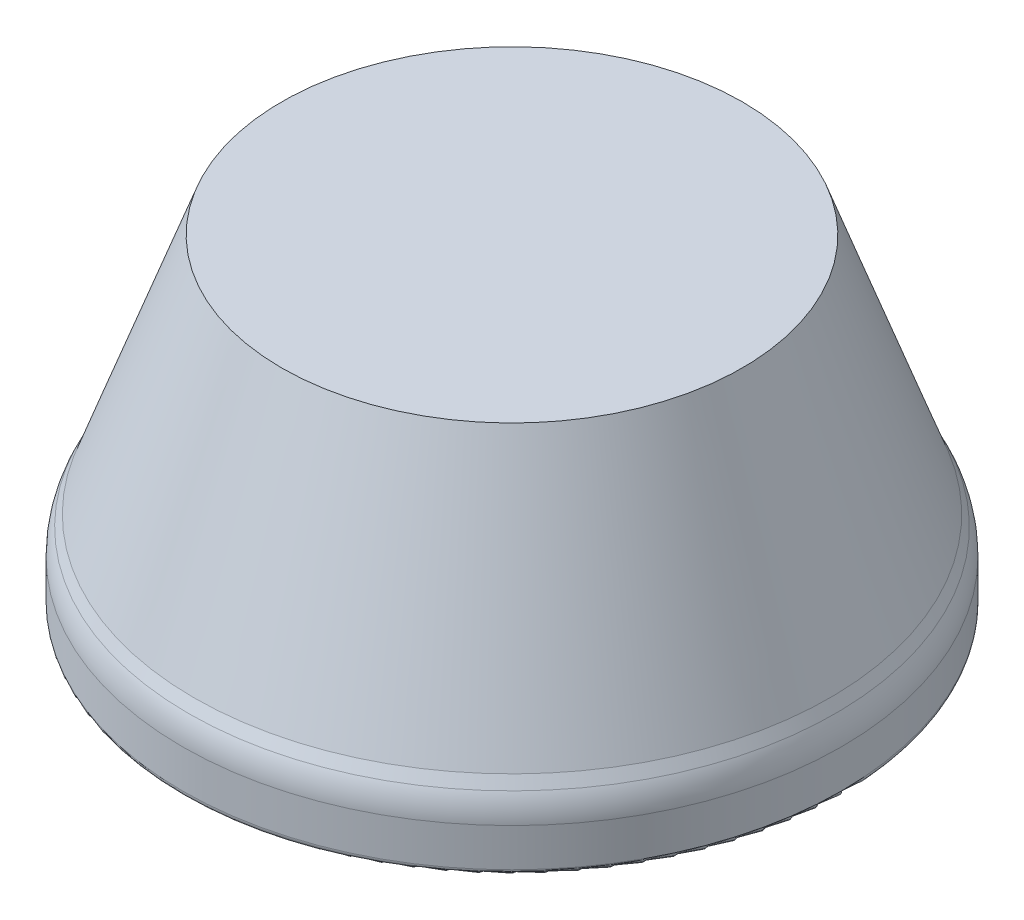
from build123d import *

# Parameters (mm, degrees)
SKETCH33_R          = 28.6
SKETCH33_R_2        = 27.6
BOSS_EXTRUDE7_DEPTH = 5
BOSS_EXTRUDE8_START = 22
SKETCH33_11_R       = 20
BOSS_EXTRUDE8_DEPTH = 1
SKETCH33_12_R       = 27.6
SKETCH33_12_R_2     = 26
BOSS_EXTRUDE9_DEPTH = 2
SKETCH33_14_R       = 26
SKETCH33_14_R_2     = 20
CUT_EXTRUDE1_DEPTH  = 4.5
FILLET1_R           = 0.5
FILLET3_R           = 5


with BuildPart() as part:
    # Sketch33 → Boss-Extrude7 (new body)
    with BuildSketch(Plane(origin=(0, 0, 0), x_dir=(1, 0, 0), z_dir=(0, 1, 0))):
        with Locations(Location((0, 0, 0), (0, 0, 270))):
            Circle(SKETCH33_R)
        with Locations(Location((0, 0, 0), (0, 0, 270))):
            Circle(SKETCH33_R_2, mode=Mode.SUBTRACT)
    extrude(amount=-BOSS_EXTRUDE7_DEPTH)



with BuildPart() as body_2:
    # Sketch33<11> → Boss-Extrude8 (new body)
    with BuildSketch(Plane(origin=(0, 0, 0), x_dir=(1, 0, 0), z_dir=(0, 1, 0)).offset(BOSS_EXTRUDE8_START)):
        with Locations(Location((0, 0, 0), (0, 0, 270))):
            Circle(SKETCH33_11_R)
    extrude(amount=BOSS_EXTRUDE8_DEPTH)


with BuildPart() as body_3:
    # Sketch33<12> → Boss-Extrude9 (new body)
    with BuildSketch(Plane(origin=(0, 0, 0), x_dir=(1, 0, 0), z_dir=(0, 1, 0))):
        with Locations(Location((0, 0, 0), (0, 0, 270))):
            Circle(SKETCH33_12_R)
        with Locations(Location((0, 0, 0), (0, 0, 270))):
            Circle(SKETCH33_12_R_2, mode=Mode.SUBTRACT)
    extrude(amount=BOSS_EXTRUDE9_DEPTH)


with BuildPart() as part_1:
    add(part.part)

    add(body_3.part)  # loft5 joins it to this body
    # loft up to a face of the part (loft5)
    loft([Face(Wire([part_1.edges().sort_by_distance((20.848502744, 0, -19.57804723))[0]])), Face(Wire([part_1.edges().sort_by_distance((20.119534117, 2, -18.893500124))[0]]))])

    # Sketch33<14> → Cut-Extrude1 (cut)
    # profile 1 of 2: a face of its own
    with BuildSketch(Plane(origin=(0, 0, 0), x_dir=(1, 0, 0), z_dir=(0, 1, 0))):
        with Locations(Location((0, 0, 0), (0, 0, 270))):
            Circle(SKETCH33_14_R)
        with Locations(Location((0, 0, 0), (0, 0, 270))):
            Circle(SKETCH33_14_R_2, mode=Mode.SUBTRACT)
    # profile 2 of 2: a face of its own
    with BuildSketch(Plane(origin=(0, 0, 0), x_dir=(1, 0, 0), z_dir=(0, 1, 0))):
        with Locations(Location((0, 0, 0), (0, 0, 270))):
            Circle(SKETCH33_14_R_2)
    extrude(amount=CUT_EXTRUDE1_DEPTH, mode=Mode.SUBTRACT)


    add(body_2.part)  # loft6 joins it to this body
    # loft up to a face of the part (loft6)
    loft([Face(Wire([part_1.edges().sort_by_distance((20.119534117, 2, -18.893500124))[0]])), Face(Wire([part_1.edges().sort_by_distance((14.579372548, 23, -13.690942119))[0]]))])

    # Sketch35 → Cut-Revolve4 (revolve, cut)
    with BuildSketch(Plane.XY, mode=Mode.PRIVATE) as cut_revolve4_sk:
        Polygon((-26, 2), (-19, 22), (0, 22), (0, 2), align=None)
    revolve(cut_revolve4_sk.sketch.rotate(Axis((0, 22, 0), (0, -1, 0)), 270), axis=Axis((0, 22, 0), (0, -1, 0)), mode=Mode.SUBTRACT)

    # Fillet1
    fillet1_edges = [part_1.edges().sort_by_distance(p)[0] for p in [
        (0, -5, -28.6),
        (0, -5, -27.6),
    ]]
    fillet(fillet1_edges, radius=FILLET1_R - 0.0001)  # a hair under: the kernel refuses the full size

    # Fillet3
    fillet3_edges = [part_1.edges().sort_by_distance(p)[0] for p in [
        (0, 0, -28.6),
    ]]
    fillet(fillet3_edges, radius=FILLET3_R)


solid = part_1.part
